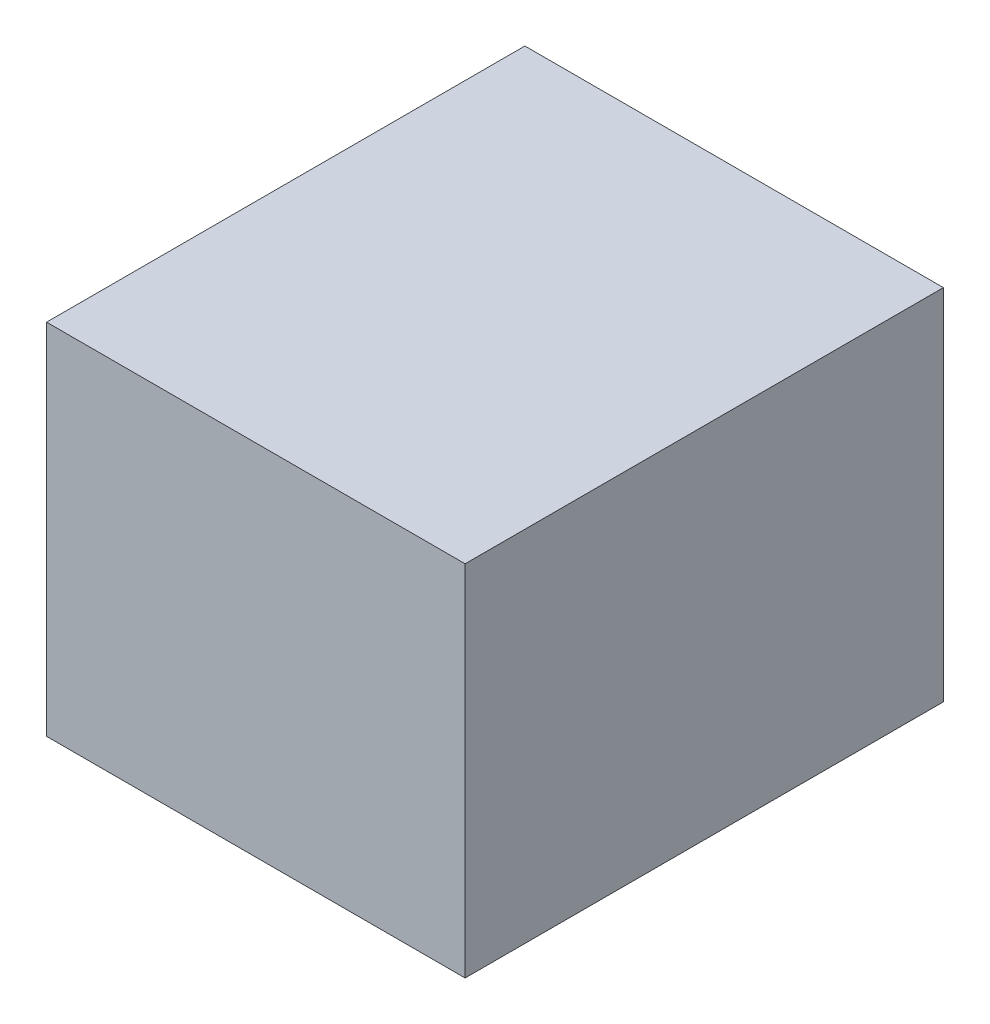
from build123d import *

# Parameters (mm, degrees)
SKETCH1_W           = 711.2
SKETCH1_H           = 812.8
BOSS_EXTRUDE1_DEPTH = 304.8


with BuildPart() as part:
    # Sketch1 → Boss-Extrude1 (new, symmetric)
    with BuildSketch(Plane(origin=(0, 0, 0), x_dir=(1, 0, 0), z_dir=(0, 1, 0))):
        Rectangle(SKETCH1_W, SKETCH1_H)
    extrude(amount=BOSS_EXTRUDE1_DEPTH, both=True)


solid = part.part
